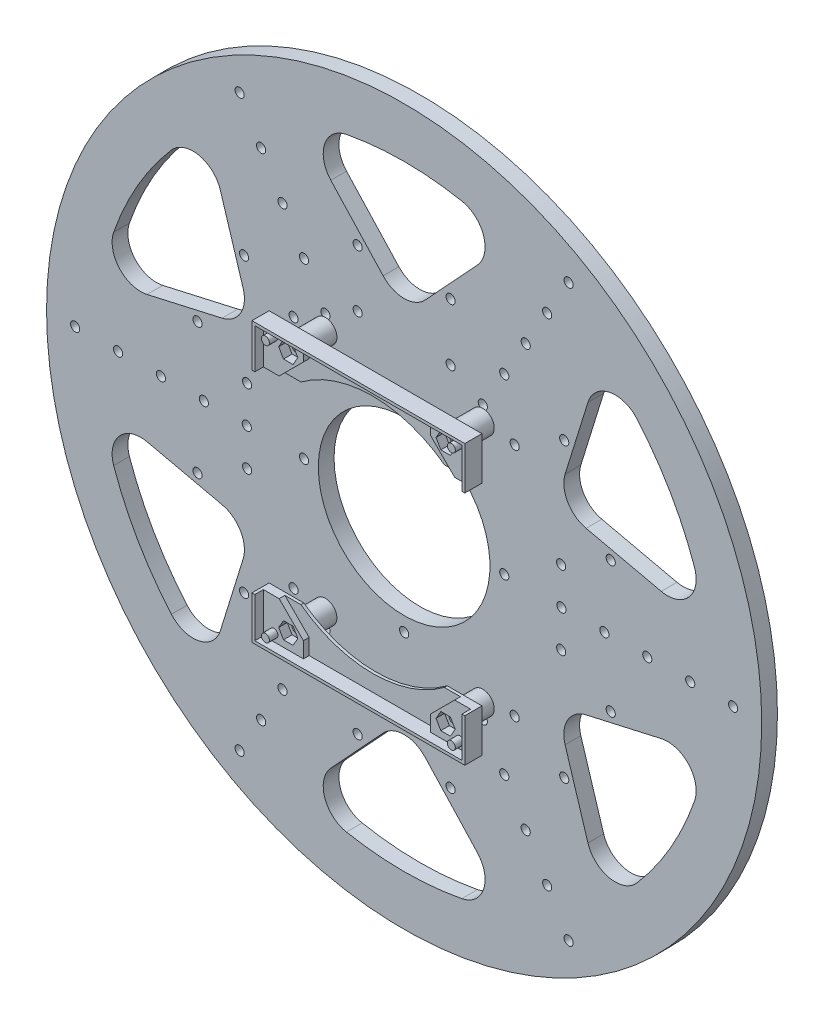
from build123d import *

# Parameters (mm, degrees)
SKETCH_1_R               = 125
EXTRUDE_1_DEPTH          = 5.5
SKETCH_3_R               = 1.6
CUT_EXTRUDE_1_DEPTH      = 177.862234522
PATTERN_CIRCULAR_1_COUNT = 6
SKETCH_4_R               = 30
SKETCH_4_R_2             = 1.6
CUT_EXTRUDE_2_DEPTH      = 177.862234522
SKETCH_5_R               = 1.6
CUT_EXTRUDE_3_DEPTH      = 177.862234522
SKETCH_6_R               = 1.6
CUT_EXTRUDE_4_DEPTH      = 177.862234522
SKETCH_7_R               = 4
SKETCH_7_R_2             = 1.8
EXTRUDE_2_DEPTH          = 10
EXTRUDE_2_2_DEPTH        = 10
EXTRUDE_2_3_DEPTH        = 10
EXTRUDE_2_4_DEPTH        = 10
EXTRUDE_3_DEPTH          = 1
EXTRUDE_4_DEPTH          = 5
EXTRUDE_5_DEPTH          = 2
SKETCH_12_R              = 1.4
EXTRUDE_6_DEPTH          = 3
CUT_EXTRUDE_5_DEPTH      = 178.454923854


with BuildPart() as part:
    # ｽｹｯﾁ1 → ﾎﾞｽ - 押し出し1 (new body)
    with BuildSketch(Plane.XY):
        Circle(SKETCH_1_R)
    extrude(amount=EXTRUDE_1_DEPTH)

    # ｽｹｯﾁ3 → ｶｯﾄ - 押し出し1 (cut, through all)
    with BuildSketch(Plane(origin=(0, 0, 0), x_dir=(-1, 0, 0), z_dir=(0, 0, -1))):
        with Locations((-16.25, 74)):
            Circle(SKETCH_3_R)
        with Locations((-16.25, 54)):
            Circle(SKETCH_3_R)
        with Locations((16.25, 54)):
            Circle(SKETCH_3_R)
        with Locations((16.25, 74)):
            Circle(SKETCH_3_R)
        with BuildLine():
            Line((-25.629768191, 88.978306263), (-7.34049422, 69.209039494))
            ThreePointArc((-7.34049422, 69.209039494), (0, 66), (7.34049422, 69.209039494))
            Line((7.34049422, 69.209039494), (25.629768191, 88.978306263))
            ThreePointArc((25.629768191, 88.978306263), (27.788579257, 98.893878596), (20.165096942, 105.591755669))
            ThreePointArc((20.165096942, 105.591755669), (0, 107.5), (-20.165096942, 105.591755669))
            ThreePointArc((-20.165096942, 105.591755669), (-27.788579257, 98.893878596), (-25.629768191, 88.978306263))
        make_face()
    cut_extrude_1 = extrude(amount=-CUT_EXTRUDE_1_DEPTH, mode=Mode.SUBTRACT)

    # 円形ﾊﾟﾀｰﾝ1: ｶｯﾄ - 押し出し1 ×6 about axis
    pattern_circular_1_axis = Axis((0, 0, 0), (0, 0, 1))
    for i in range(1, PATTERN_CIRCULAR_1_COUNT):
        add(cut_extrude_1.rotate(pattern_circular_1_axis, i * 360 / PATTERN_CIRCULAR_1_COUNT), mode=Mode.SUBTRACT)

    # ｽｹｯﾁ4 → ｶｯﾄ - 押し出し2 (cut, through all)
    with BuildSketch(Plane(origin=(0, 0, 0), x_dir=(-1, 0, 0), z_dir=(0, 0, -1))):
        Circle(SKETCH_4_R)
        with Locations((0, 35)):
            Circle(SKETCH_4_R_2)
        with Locations((35, 0)):
            Circle(SKETCH_4_R_2)
        with Locations((0, -35)):
            Circle(SKETCH_4_R_2)
        with Locations((-35, 0)):
            Circle(SKETCH_4_R_2)
    extrude(amount=-CUT_EXTRUDE_2_DEPTH, mode=Mode.SUBTRACT)

    # ｽｹｯﾁ5 → ｶｯﾄ - 押し出し3 (cut, through all)
    with BuildSketch(Plane(origin=(0, 0, 0), x_dir=(-1, 0, 0), z_dir=(0, 0, -1))):
        with Locations((-27.5, 42.5)):
            Circle(SKETCH_5_R)
        with Locations((27.5, 42.5)):
            Circle(SKETCH_5_R)
        with Locations((-27.5, -42.5)):
            Circle(SKETCH_5_R)
        with Locations((27.5, -42.5)):
            Circle(SKETCH_5_R)
    extrude(amount=-CUT_EXTRUDE_3_DEPTH, mode=Mode.SUBTRACT)

    # ｽｹｯﾁ6 → ｶｯﾄ - 押し出し4 (cut, through all)
    with BuildSketch(Plane(origin=(0, 0, 0), x_dir=(-1, 0, 0), z_dir=(0, 0, -1))):
        with Locations((-115, 0)):
            Circle(SKETCH_6_R)
        with Locations((-100, 0)):
            Circle(SKETCH_6_R)
        with Locations((-85, 0)):
            Circle(SKETCH_6_R)
        with Locations((-70, 0)):
            Circle(SKETCH_6_R)
        with Locations((-55, 0)):
            Circle(SKETCH_6_R)
        with Locations((-57.5, 99.592921435)):
            Circle(SKETCH_6_R)
        with Locations((-50, 86.602540378)):
            Circle(SKETCH_6_R)
        with Locations((-42.5, 73.612159322)):
            Circle(SKETCH_6_R)
        with Locations((-35, 60.621778265)):
            Circle(SKETCH_6_R)
        with Locations((-27.5, 47.631397208)):
            Circle(SKETCH_6_R)
        with Locations((57.5, 99.592921435)):
            Circle(SKETCH_6_R)
        with Locations((50, 86.602540378)):
            Circle(SKETCH_6_R)
        with Locations((42.5, 73.612159322)):
            Circle(SKETCH_6_R)
        with Locations((35, 60.621778265)):
            Circle(SKETCH_6_R)
        with Locations((27.5, 47.631397208)):
            Circle(SKETCH_6_R)
        with Locations((115, 0)):
            Circle(SKETCH_6_R)
        with Locations((100, 0)):
            Circle(SKETCH_6_R)
        with Locations((85, 0)):
            Circle(SKETCH_6_R)
        with Locations((70, 0)):
            Circle(SKETCH_6_R)
        with Locations((55, 0)):
            Circle(SKETCH_6_R)
        with Locations((57.5, -99.592921435)):
            Circle(SKETCH_6_R)
        with Locations((50, -86.602540378)):
            Circle(SKETCH_6_R)
        with Locations((42.5, -73.612159322)):
            Circle(SKETCH_6_R)
        with Locations((35, -60.621778265)):
            Circle(SKETCH_6_R)
        with Locations((27.5, -47.631397208)):
            Circle(SKETCH_6_R)
        with Locations((-57.5, -99.592921435)):
            Circle(SKETCH_6_R)
        with Locations((-50, -86.602540378)):
            Circle(SKETCH_6_R)
        with Locations((-42.5, -73.612159322)):
            Circle(SKETCH_6_R)
        with Locations((-35, -60.621778265)):
            Circle(SKETCH_6_R)
        with Locations((-27.5, -47.631397208)):
            Circle(SKETCH_6_R)
    extrude(amount=-CUT_EXTRUDE_4_DEPTH, mode=Mode.SUBTRACT)


with BuildPart() as body_2:
    # ｽｹｯﾁ7 → ﾎﾞｽ - 押し出し2 (new body)
    with BuildSketch(Plane(origin=(0, 0, 5.5), x_dir=(-1, 0, 0), z_dir=(0, 0, -1))):
        with Locations((-27.5, 42.5)):
            Circle(SKETCH_7_R)
        with Locations((-27.5, 42.5)):
            Circle(SKETCH_7_R_2, mode=Mode.SUBTRACT)
    extrude(amount=-EXTRUDE_2_DEPTH)



with BuildPart() as body_3:
    # ｽｹｯﾁ7 → Extrude 2 2 (new body)
    with BuildSketch(Plane(origin=(0, 0, 5.5), x_dir=(-1, 0, 0), z_dir=(0, 0, -1))):
        with Locations((27.5, 42.5)):
            Circle(SKETCH_7_R)
        with Locations((27.5, 42.5)):
            Circle(SKETCH_7_R_2, mode=Mode.SUBTRACT)
    extrude(amount=-EXTRUDE_2_2_DEPTH)


with BuildPart() as body_4:
    # ｽｹｯﾁ7 → Extrude 2 3 (new body)
    with BuildSketch(Plane(origin=(0, 0, 5.5), x_dir=(-1, 0, 0), z_dir=(0, 0, -1))):
        with Locations((-27.5, -42.5)):
            Circle(SKETCH_7_R)
        with Locations((-27.5, -42.5)):
            Circle(SKETCH_7_R_2, mode=Mode.SUBTRACT)
    extrude(amount=-EXTRUDE_2_3_DEPTH)


with BuildPart() as body_5:
    # ｽｹｯﾁ7 → Extrude 2 4 (new body)
    with BuildSketch(Plane(origin=(0, 0, 5.5), x_dir=(-1, 0, 0), z_dir=(0, 0, -1))):
        with Locations((27.5, -42.5)):
            Circle(SKETCH_7_R)
        with Locations((27.5, -42.5)):
            Circle(SKETCH_7_R_2, mode=Mode.SUBTRACT)
    extrude(amount=-EXTRUDE_2_4_DEPTH)


with BuildPart() as body_2_1:
    add(body_2.part)

    add(body_3.part)  # ﾎﾞｽ - 押し出し3 merges body 3

    add(body_4.part)  # ﾎﾞｽ - 押し出し3 merges body 4

    add(body_5.part)  # ﾎﾞｽ - 押し出し3 merges body 5
    # ｽｹｯﾁ8 → ﾎﾞｽ - 押し出し3 (add)
    with BuildSketch(Plane.XY.offset(15.5)):
        with BuildLine():
            Line((37.2, -48.7), (-37.2, -48.7))
            Line((-37.2, -48.7), (-37.2, -33.7))
            Line((-37.2, -33.7), (-25.066112583, -33.7))
            ThreePointArc((-25.066112583, -33.7), (0, -42), (25.066112583, -33.7))
            Line((25.066112583, -33.7), (37.2, -33.7))
            Line((37.2, -33.7), (37.2, -48.7))
        make_face()
        with BuildLine():
            Line((37.2, 48.7), (-37.2, 48.7))
            Line((-37.2, 48.7), (-37.2, 33.7))
            Line((-37.2, 33.7), (-25.066112583, 33.7))
            ThreePointArc((-25.066112583, 33.7), (0, 42), (25.066112583, 33.7))
            Line((25.066112583, 33.7), (37.2, 33.7))
            Line((37.2, 33.7), (37.2, 48.7))
        make_face()
    extrude(amount=EXTRUDE_3_DEPTH)

    # ｽｹｯﾁ10 → ﾎﾞｽ - 押し出し4 (add)
    with BuildSketch(Plane.XY.offset(16.5)):
        Polygon((37.2, 33.7), (37.2, 48.7), (-37.2, 48.7), (-37.2, 33.7), (-36.2, 33.7), (-36.2, 47.7), (36.2, 47.7), (36.2, 33.7), align=None)
        Polygon((36.2, -33.7), (37.2, -33.7), (37.2, -48.7), (-37.2, -48.7), (-37.2, -33.7), (-36.2, -33.7), (-36.2, -47.7), (36.2, -47.7), align=None)
    extrude(amount=EXTRUDE_4_DEPTH)

    # ｽｹｯﾁ11 → ﾎﾞｽ - 押し出し5 (add)
    with BuildSketch(Plane.XY.offset(16.5)):
        Polygon((-36.2, 47.7), (-36.2, 33.7), (-30.685281374, 33.7), (-22.2, 42.185281374), (-22.2, 47.7), align=None)
        Polygon((22.2, 42.185281374), (30.685281374, 33.7), (36.2, 33.7), (36.2, 47.7), (22.2, 47.7), align=None)
        Polygon((36.2, -47.7), (36.2, -33.7), (30.685281374, -33.7), (22.2, -42.185281374), (22.2, -47.7), align=None)
        Polygon((-22.2, -42.185281374), (-30.685281374, -33.7), (-36.2, -33.7), (-36.2, -47.7), (-22.2, -47.7), align=None)
    extrude(amount=EXTRUDE_5_DEPTH)

    # ｽｹｯﾁ12 → ﾎﾞｽ - 押し出し6 (add)
    with BuildSketch(Plane.XY.offset(18.5)):
        with Locations((-32.5, 45)):
            Circle(SKETCH_12_R)
        with Locations((32.5, 45)):
            Circle(SKETCH_12_R)
        with Locations((-32.5, -45)):
            Circle(SKETCH_12_R)
        with Locations((32.5, -45)):
            Circle(SKETCH_12_R)
    extrude(amount=EXTRUDE_6_DEPTH)

    # ｽｹｯﾁ13 → ｶｯﾄ - 押し出し5 (cut, through all)
    with BuildSketch(Plane(origin=(0, 0, 15.5), x_dir=(-1, 0, 0), z_dir=(0, 0, -1))):
        Polygon((-29.174315781, 39.6), (-25.825684219, 39.6), (-24.151368439, 42.5), (-25.825684219, 45.4), (-29.174315781, 45.4), (-30.848631561, 42.5), align=None)
        Polygon((24.151368439, 42.5), (25.825684219, 39.6), (29.174315781, 39.6), (30.848631561, 42.5), (29.174315781, 45.4), (25.825684219, 45.4), align=None)
        Polygon((25.825684219, -45.4), (29.174315781, -45.4), (30.848631561, -42.5), (29.174315781, -39.6), (25.825684219, -39.6), (24.151368439, -42.5), align=None)
        Polygon((-30.848631561, -42.5), (-29.174315781, -45.4), (-25.825684219, -45.4), (-24.151368439, -42.5), (-25.825684219, -39.6), (-29.174315781, -39.6), align=None)
    extrude(amount=-CUT_EXTRUDE_5_DEPTH, mode=Mode.SUBTRACT)


solid = Compound([part.part, body_2_1.part])
